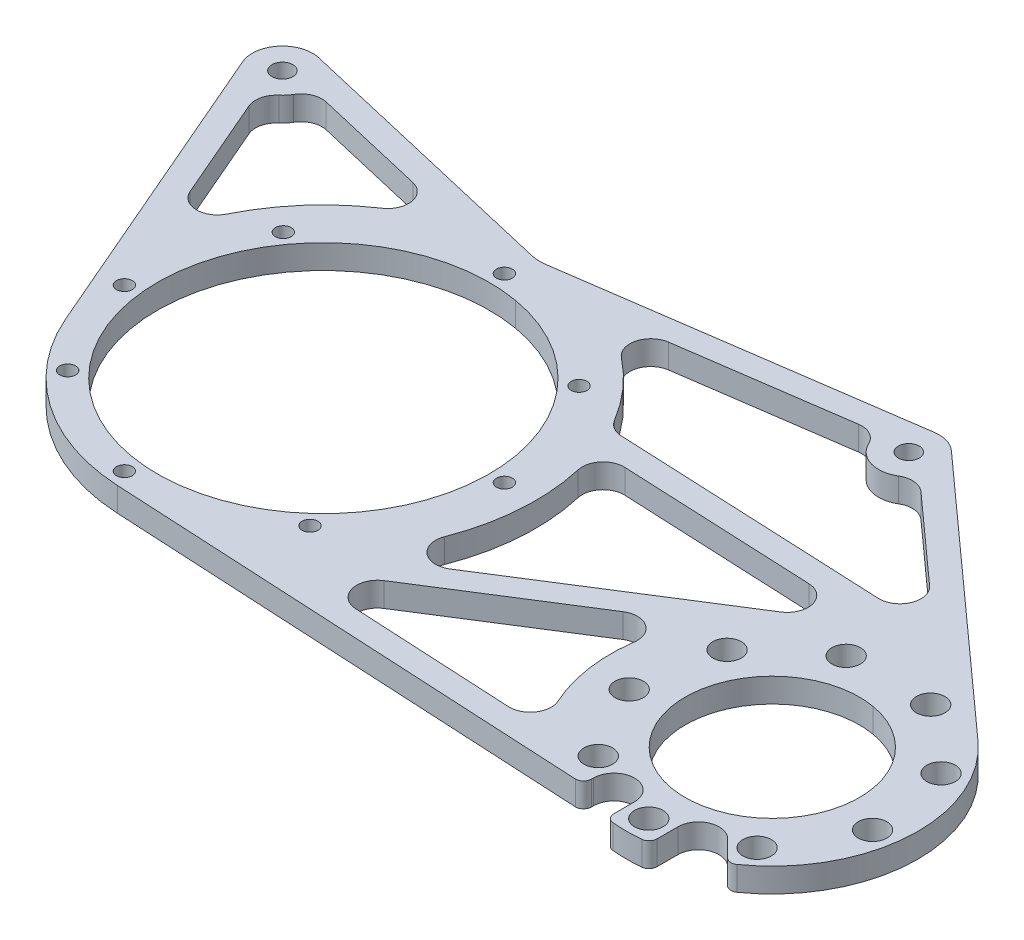
from build123d import *

# Parameters (mm, degrees)
SKETCH2_R           = 4.5
SKETCH2_R_2         = 27.4955
SKETCH2_R_3         = 2.5
SKETCH2_R_4         = 52.3875
SKETCH2_R_5         = 3.3
BOSS_EXTRUDE1_DEPTH = 7.62
CUT_EXTRUDE1_DEPTH  = 977.654400972
FILLET2_R           = 12.7
CUT_EXTRUDE2_DEPTH  = 977.654400972
FILLET3_R           = 6.604


with BuildPart() as part:
    # Sketch2 → Boss-Extrude1 (new body)
    with BuildSketch(Plane(origin=(0, 31.381947118, 0), x_dir=(1, 0, 0), z_dir=(0, 1, 0))):
        with BuildLine():
            ThreePointArc((-706.758334948, -176.701988839), (-700.258334948, -170.201988839), (-693.758334948, -176.701988839))
            Line((-693.758334948, -176.701988839), (-693.758334948, -183.274721629))
            ThreePointArc((-693.758334948, -183.274721629), (-693.101169654, -184.979577479), (-691.469725918, -185.802250576))
            ThreePointArc((-691.469725918, -185.802250576), (-686.919549358, -186.027976628), (-682.369372798, -185.802250576))
            ThreePointArc((-682.369372798, -185.802250576), (-680.737929062, -184.979577479), (-680.080763768, -183.274721629))
            Line((-680.080763768, -183.274721629), (-680.080763768, -176.701988839))
            ThreePointArc((-680.080763768, -176.701988839), (-676.068206079, -170.696771877), (-668.984569691, -172.105794761))
            Line((-668.984569691, -172.105794761), (-663.719686073, -177.370678379))
            ThreePointArc((-663.719686073, -177.370678379), (-662.142049476, -178.105218992), (-660.461885462, -177.651858179))
            ThreePointArc((-660.461885462, -177.651858179), (-641.02731599, -142.794705094), (-656.175138478, -105.872258186))
            Line((-656.175138478, -105.872258186), (-739.714556945, -30.733548866))
            ThreePointArc((-739.714556945, -30.733548866), (-742.67316861, -28.92213442), (-746.084255332, -28.29039661))
            Line((-746.084255332, -28.29039661), (-949.218629158, -22.875315026))
            ThreePointArc((-949.218629158, -22.875315026), (-957.176615495, -27.166188695), (-957.964688125, -36.172857609))
            Line((-957.964688125, -36.172857609), (-915.540423748, -134.526980787))
            ThreePointArc((-915.540423748, -134.526980787), (-894.053054389, -160.825584136), (-861.92593364, -171.83338557))
            Line((-861.92593364, -171.83338557), (-709.298334948, -179.818999281))
            ThreePointArc((-709.298334948, -179.818999281), (-707.502283723, -179.075050505), (-706.758334948, -177.278999281))
            Line((-706.758334948, -177.278999281), (-706.758334948, -176.701988839))
        make_face()
        with Locations((-686.919549358, -179.053976628)):
            Circle(SKETCH2_R, mode=Mode.SUBTRACT)
        with Locations((-711.988266136, -169.92970991)):
            Circle(SKETCH2_R, mode=Mode.SUBTRACT)
        with Locations((-661.85083258, -169.92970991)):
            Circle(SKETCH2_R, mode=Mode.SUBTRACT)
        with Locations((-725.327051725, -146.826255557)):
            Circle(SKETCH2_R, mode=Mode.SUBTRACT)
        with Locations((-686.919549358, -140.053976628)):
            Circle(SKETCH2_R_2, mode=Mode.SUBTRACT)
        with Locations((-648.51204699, -146.826255557)):
            Circle(SKETCH2_R, mode=Mode.SUBTRACT)
        with Locations((-720.694540106, -120.553976628)):
            Circle(SKETCH2_R, mode=Mode.SUBTRACT)
        with Locations((-653.14455861, -120.553976628)):
            Circle(SKETCH2_R, mode=Mode.SUBTRACT)
        with Locations((-700.258334948, -103.405964417)):
            Circle(SKETCH2_R, mode=Mode.SUBTRACT)
        with Locations((-673.580763768, -103.405964417)):
            Circle(SKETCH2_R, mode=Mode.SUBTRACT)
        with Locations((-816.220313684, -71.764639846)):
            Circle(SKETCH2_R_3, mode=Mode.SUBTRACT)
        with Locations((-858.69104046, -52.855453999)):
            Circle(SKETCH2_R_3, mode=Mode.SUBTRACT)
        with Locations((-901.161767236, -148.246268152)):
            Circle(SKETCH2_R_3, mode=Mode.SUBTRACT)
        with Locations((-864.664842136, -166.842380319)):
            Circle(SKETCH2_R_3, mode=Mode.SUBTRACT)
        with Locations((-820.450226307, -152.476180775)):
            Circle(SKETCH2_R_3, mode=Mode.SUBTRACT)
        with Locations((-915.52796678, -115.979255675)):
            Circle(SKETCH2_R_3, mode=Mode.SUBTRACT)
        with Locations((-858.69104046, -110.005453999)):
            Circle(SKETCH2_R_4, mode=Mode.SUBTRACT)
        with Locations((-801.54104046, -110.005453999)):
            Circle(SKETCH2_R_3, mode=Mode.SUBTRACT)
        with Locations((-904.926361688, -76.41352683)):
            Circle(SKETCH2_R_3, mode=Mode.SUBTRACT)
        with Locations((-949.218629158, -32.400315026)):
            Circle(SKETCH2_R_5, mode=Mode.SUBTRACT)
        with Locations((-746.084255332, -37.81539661)):
            Circle(SKETCH2_R_5, mode=Mode.SUBTRACT)
    extrude(amount=BOSS_EXTRUDE1_DEPTH)

    # Sketch3 → Cut-Extrude1 (cut, through all)
    with BuildSketch(Plane.XZ.offset(-31.381947118)):
        with BuildLine():
            ThreePointArc((-746.084255332, 28.29039661), (-746.764244179, 28.314699785), (-747.440763024, 28.387485289))
            Line((-747.440763024, 28.387485289), (-856.972172798, 44.147094697))
            Line((-856.972172798, 44.147094697), (-947.053929007, 23.124556391))
            ThreePointArc((-947.053929007, 23.124556391), (-947.877357404, 22.970224089), (-948.71116187, 22.888842903))
            Line((-948.71116187, 22.888842903), (-746.084255332, 28.29039661))
        make_face()
    extrude(amount=-CUT_EXTRUDE1_DEPTH, mode=Mode.SUBTRACT)

    # Fillet2
    fillet2_edges = [part.edges().sort_by_distance(p)[0] for p in [
        (-856.972172798, 35.191947118, 44.147094697),
    ]]
    fillet(fillet2_edges, radius=FILLET2_R)

    # Sketch4 → Cut-Extrude2 (cut, through all)
    with BuildSketch(Plane.XZ.offset(-31.381947118)):
        with BuildLine():
            ThreePointArc((-755.592985701, 37.258915017), (-748.851749471, 46.929484671), (-737.871550291, 42.640031406))
            Line((-737.871550291, 42.640031406), (-692.514052151, 83.436387555))
            Line((-692.514052151, 83.436387555), (-799.512254655, 78.606945008))
            ThreePointArc((-799.512254655, 78.606945008), (-813.418024568, 60.625811551), (-832.535963077, 48.329632291))
            Line((-832.535963077, 48.329632291), (-755.592985701, 37.258915017))
        make_face()
        with BuildLine():
            Line((-924.087998396, 95.47159873), (-947.271519207, 41.724176235))
            ThreePointArc((-947.271519207, 41.724176235), (-941.911570095, 38.510348812), (-939.697338874, 32.666127625))
            Line((-939.697338874, 32.666127625), (-880.184963158, 46.554635696))
            ThreePointArc((-880.184963158, 46.554635696), (-908.548072085, 65.25870603), (-924.087998396, 95.47159873))
        make_face()
        with BuildLine():
            ThreePointArc((-732.476443701, 117.008797222), (-737.745943415, 144.869429162), (-727.337961012, 171.244727106))
            Line((-727.337961012, 171.244727106), (-811.290400037, 166.852259728))
            Line((-811.290400037, 166.852259728), (-732.476443701, 117.008797222))
        make_face()
        with BuildLine():
            Line((-704.829350056, 90.508285443), (-812.734441613, 158.749541627))
            ThreePointArc((-812.734441613, 158.749541627), (-793.421898525, 125.102942774), (-795.997635489, 86.393337843))
            Line((-795.997635489, 86.393337843), (-704.829350056, 90.508285443))
        make_face()
    extrude(amount=-CUT_EXTRUDE2_DEPTH, mode=Mode.SUBTRACT)

    # Fillet3
    fillet3_edges = [part.edges().sort_by_distance(p)[0] for p in [
        (-732.476443701, 35.191947118, 117.008797222),
        (-727.337961012, 35.191947118, 171.244727106),
        (-811.290400037, 35.191947118, 166.852259728),
        (-704.829350056, 35.191947118, 90.508285443),
        (-795.997635489, 35.191947118, 86.393337843),
        (-812.734441613, 35.191947118, 158.749541627),
        (-692.514052151, 35.191947118, 83.436387555),
        (-799.512254655, 35.191947118, 78.606945008),
        (-832.535963077, 35.191947118, 48.329632291),
        (-880.184963158, 35.191947118, 46.554635696),
        (-924.087998396, 35.191947118, 95.47159873),
        (-737.871550291, 35.191947118, 42.640031406),
        (-755.592985701, 35.191947118, 37.258915017),
        (-939.697338874, 35.191947118, 32.666127625),
        (-947.271519207, 35.191947118, 41.724176235),
    ]]
    fillet(fillet3_edges, radius=FILLET3_R)


solid = part.part
